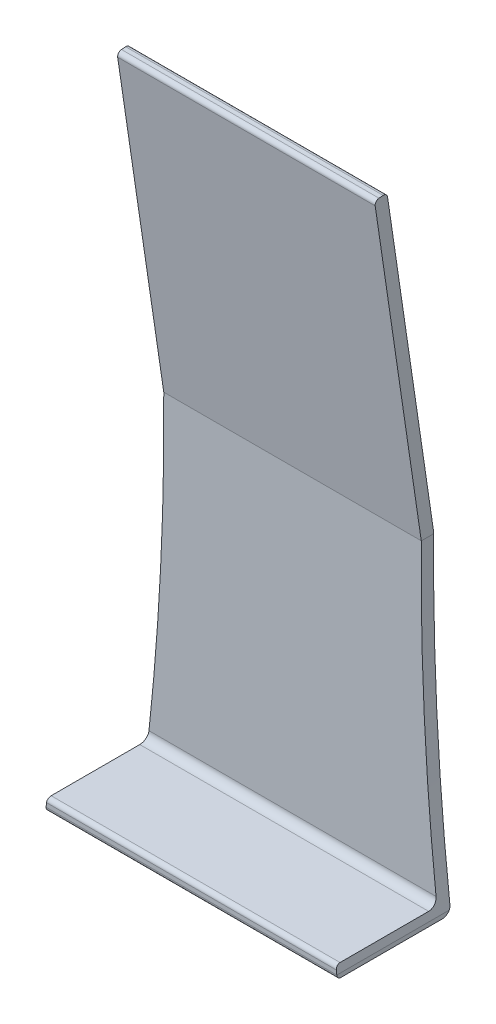
from build123d import *
from OCP.BRepAlgoAPI import BRepAlgoAPI_Cut
from OCP.TopTools import TopTools_ListOfShape

# Parameters (mm, degrees)
BOSS_EXTRUDE1_DEPTH = 70
CUT_EXTRUDE4_DEPTH  = 70


with BuildPart() as part:
    # Sketch1 → Boss-Extrude1 (new body)
    with BuildSketch(Plane(origin=(0, 0, 0), x_dir=(0, 0, -1), z_dir=(1, 0, 0))):
        with BuildLine():
            Line((1, 0), (25.334184189, 0))
            ThreePointArc((25.334184189, 0), (26.748397751, 0.585786438), (27.334184189, 2))
            Line((27.334184189, 2), (27.334184189, 77.577100538))
            Line((27.334184189, 77.577100538), (16.217438852, 153.114908847))
            ThreePointArc((16.217438852, 153.114908847), (15.853623852, 153.749510415), (15.155100701, 153.966641506))
            Line((15.155100701, 153.966641506), (14.155100701, 153.893451695))
            ThreePointArc((14.155100701, 153.893451695), (13.447894018, 153.521647944), (13.238751678, 152.750519677))
            Line((13.238751678, 152.750519677), (24.334184189, 77.357531107))
            Line((24.334184189, 77.357531107), (24.334184189, 5))
            ThreePointArc((24.334184189, 5), (23.748397751, 3.585786438), (22.334184189, 3))
            Line((22.334184189, 3), (1, 3))
            ThreePointArc((1, 3), (0.292893219, 2.707106781), (0, 2))
            Line((0, 2), (0, 1))
            ThreePointArc((0, 1), (0.292893219, 0.292893219), (1, 0))
        make_face()
    extrude(amount=BOSS_EXTRUDE1_DEPTH)


with BuildPart() as cut_extrude4_tool:
    # Sketch2 → Cut-Extrude4 (new body)
    with BuildSketch(Plane.XY):
        with BuildLine():
            Line((0, 1), (0, 154.250011553))
            Line((0, 154.250011553), (4, 154.250011553))
            Line((4, 154.250011553), (4, 77.357531107))
            add(Edge.make_bspline(
                [(4, 77.357531107), (4.361118304, 39.105803732), (0, 1)],
                knots=[0, 0, 0, 1, 1, 1], degree=2))
        make_face()
        with BuildLine():
            Line((70, 154.250011553), (66, 154.250011553))
            Line((66, 154.250011553), (66, 77.357531107))
            add(Edge.make_bspline(
                [(66, 77.357531107), (65.638881696, 39.105803732), (70, 1)],
                knots=[0, 0, 0, 1, 1, 1], degree=2))
            Line((70, 1), (70, 154.250011553))
        make_face()
    extrude(amount=-CUT_EXTRUDE4_DEPTH)


with BuildPart() as part_1:
    add(part.part)

    # Cut-Extrude4: cut by cut_extrude4_tool, with a tolerance
    cut_extrude4_stock = TopTools_ListOfShape()
    cut_extrude4_stock.Append(part_1.part.wrapped)
    cut_extrude4_tools = TopTools_ListOfShape()
    cut_extrude4_tools.Append(cut_extrude4_tool.part.wrapped)
    cut_extrude4_cut = BRepAlgoAPI_Cut()
    cut_extrude4_cut.SetArguments(cut_extrude4_stock)
    cut_extrude4_cut.SetTools(cut_extrude4_tools)
    cut_extrude4_cut.SetFuzzyValue(0.00001)
    cut_extrude4_cut.Build()
    add(Compound.cast(cut_extrude4_cut.Shape()).solids(), mode=Mode.REPLACE)


solid = part_1.part
